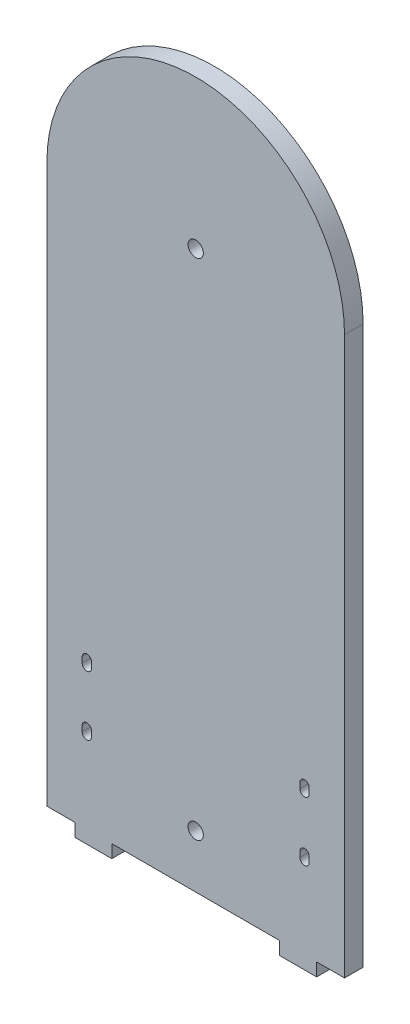
from build123d import *

# Parameters (mm, degrees)
SKETCH_1_R      = 4.1
EXTRUDE_1_DEPTH = 10


with BuildPart() as part:
    # 草圖1 → 填料-伸長1 (new body)
    with BuildSketch(Plane.XY):
        with BuildLine():
            Line((-80, 0), (-65, 0))
            Line((-65, 0), (-65, -7))
            Line((-65, -7), (-45.1, -7))
            Line((-45.1, -7), (-45.1, 0))
            Line((-45.1, 0), (45.1, 0))
            Line((45.1, 0), (45.1, -7))
            Line((45.1, -7), (65, -7))
            Line((65, -7), (65, 0))
            Line((65, 0), (80, 0))
            Line((80, 0), (80, 299.5))
            ThreePointArc((80, 299.5), (0, 379.5), (-80, 299.5))
            Line((-80, 299.5), (-80, 0))
        make_face()
        with Locations((0, 299.5)):
            Circle(SKETCH_1_R, mode=Mode.SUBTRACT)
        with Locations((0, 28.5)):
            Circle(SKETCH_1_R, mode=Mode.SUBTRACT)
        with BuildLine():
            Line((-61.025, 76.1), (-61.025, 79.1))
            ThreePointArc((-61.025, 79.1), (-58.525, 81.6), (-56.025, 79.1))
            Line((-56.025, 79.1), (-56.025, 76.1))
            ThreePointArc((-56.025, 76.1), (-58.525, 73.6), (-61.025, 76.1))
        make_face(mode=Mode.SUBTRACT)
        with BuildLine():
            Line((-61.025, 44.1), (-61.025, 47.1))
            ThreePointArc((-61.025, 47.1), (-58.525, 49.6), (-56.025, 47.1))
            Line((-56.025, 47.1), (-56.025, 44.1))
            ThreePointArc((-56.025, 44.1), (-58.525, 41.6), (-61.025, 44.1))
        make_face(mode=Mode.SUBTRACT)
        with BuildLine():
            Line((61.025, 44.1), (61.025, 47.1))
            ThreePointArc((61.025, 47.1), (58.525, 49.6), (56.025, 47.1))
            Line((56.025, 47.1), (56.025, 44.1))
            ThreePointArc((56.025, 44.1), (58.525, 41.6), (61.025, 44.1))
        make_face(mode=Mode.SUBTRACT)
        with BuildLine():
            Line((61.025, 76.1), (61.025, 79.1))
            ThreePointArc((61.025, 79.1), (58.525, 81.6), (56.025, 79.1))
            Line((56.025, 79.1), (56.025, 76.1))
            ThreePointArc((56.025, 76.1), (58.525, 73.6), (61.025, 76.1))
        make_face(mode=Mode.SUBTRACT)
    extrude(amount=-EXTRUDE_1_DEPTH)


solid = part.part
